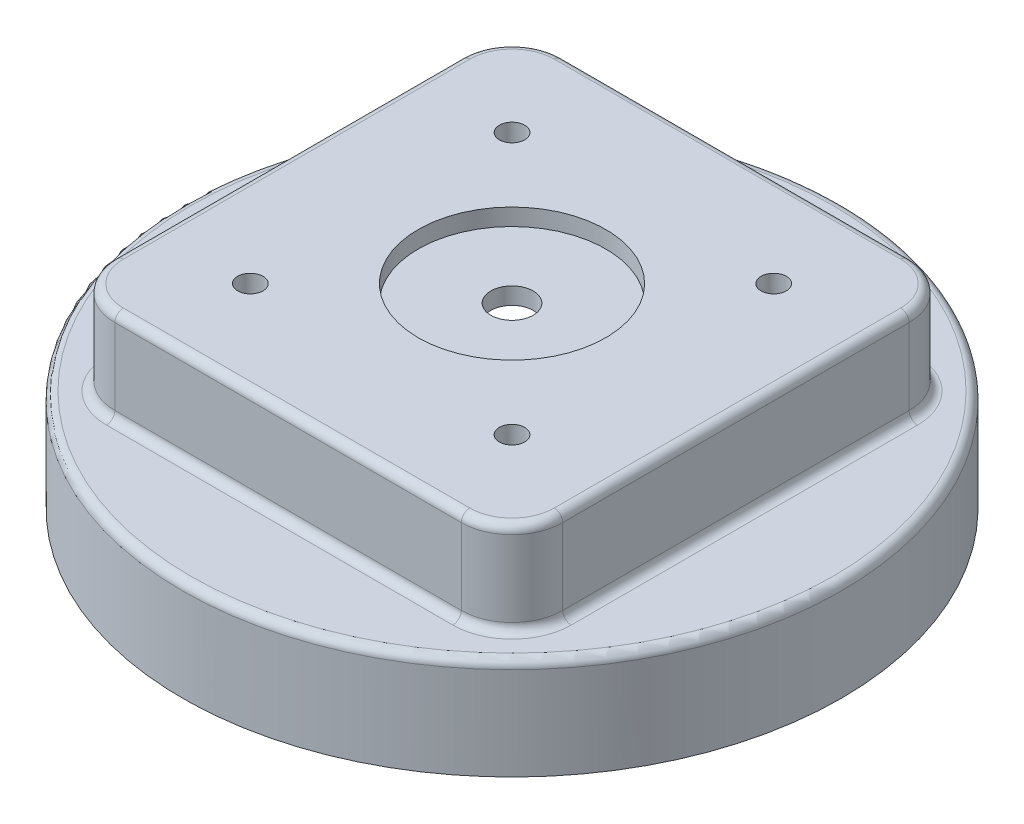
from build123d import *

# Parameters (mm, degrees)
SKETCH1_R           = 39
SKETCH1_R_2         = 35
BOSS_EXTRUDE1_DEPTH = 8
SKETCH2_R           = 39
BOSS_EXTRUDE2_DEPTH = 4
BOSS_EXTRUDE3_DEPTH = 7
BOSS_EXTRUDE4_DEPTH = 4
SKETCH5_R           = 11.1
CUT_EXTRUDE1_DEPTH  = 2
SKETCH6_R           = 1.5
SKETCH6_R_2         = 2.5
CUT_EXTRUDE2_DEPTH  = 60.757844673
FILLET1_R           = 1
FILLET2_R           = 1
SKETCH7_R           = 10.6
CUT_EXTRUDE3_DEPTH  = 50


with BuildPart() as part:
    # Sketch1 → Boss-Extrude1 (new body)
    with BuildSketch(Plane(origin=(0, 0, 0), x_dir=(1, 0, 0), z_dir=(0, 1, 0))):
        Circle(SKETCH1_R)
        Circle(SKETCH1_R_2, mode=Mode.SUBTRACT)
    extrude(amount=BOSS_EXTRUDE1_DEPTH)

    # Sketch2 → Boss-Extrude2 (add)
    with BuildSketch(Plane(origin=(0, 8, 0), x_dir=(1, 0, 0), z_dir=(0, 1, 0))):
        Circle(SKETCH2_R)
        with BuildLine():
            Line((-20.5, -22.5), (20.5, -22.5))
            ThreePointArc((20.5, -22.5), (21.914213562, -21.914213562), (22.5, -20.5))
            Line((22.5, -20.5), (22.5, 20.5))
            ThreePointArc((22.5, 20.5), (21.914213562, 21.914213562), (20.5, 22.5))
            Line((20.5, 22.5), (-20.5, 22.5))
            ThreePointArc((-20.5, 22.5), (-21.914213562, 21.914213562), (-22.5, 20.5))
            Line((-22.5, 20.5), (-22.5, -20.5))
            ThreePointArc((-22.5, -20.5), (-21.914213562, -21.914213562), (-20.5, -22.5))
        make_face(mode=Mode.SUBTRACT)
    extrude(amount=BOSS_EXTRUDE2_DEPTH)

    # Sketch3 → Boss-Extrude3 (add)
    with BuildSketch(Plane(origin=(0, 12, 0), x_dir=(1, 0, 0), z_dir=(0, 1, 0))):
        with BuildLine():
            Line((-20.5, -26.5), (20.5, -26.5))
            ThreePointArc((20.5, -26.5), (24.742640687, -24.742640687), (26.5, -20.5))
            Line((26.5, -20.5), (26.5, 20.5))
            ThreePointArc((26.5, 20.5), (24.742640687, 24.742640687), (20.5, 26.5))
            Line((20.5, 26.5), (-20.5, 26.5))
            ThreePointArc((-20.5, 26.5), (-24.742640687, 24.742640687), (-26.5, 20.5))
            Line((-26.5, 20.5), (-26.5, -20.5))
            ThreePointArc((-26.5, -20.5), (-24.742640687, -24.742640687), (-20.5, -26.5))
        make_face()
        with BuildLine():
            Line((-20.5, -22.5), (20.5, -22.5))
            ThreePointArc((20.5, -22.5), (21.914213562, -21.914213562), (22.5, -20.5))
            Line((22.5, -20.5), (22.5, 20.5))
            ThreePointArc((22.5, 20.5), (21.914213562, 21.914213562), (20.5, 22.5))
            Line((20.5, 22.5), (-20.5, 22.5))
            ThreePointArc((-20.5, 22.5), (-21.914213562, 21.914213562), (-22.5, 20.5))
            Line((-22.5, 20.5), (-22.5, -20.5))
            ThreePointArc((-22.5, -20.5), (-21.914213562, -21.914213562), (-20.5, -22.5))
        make_face(mode=Mode.SUBTRACT)
    extrude(amount=BOSS_EXTRUDE3_DEPTH)

    # Sketch4 → Boss-Extrude4 (add)
    with BuildSketch(Plane(origin=(0, 19, 0), x_dir=(1, 0, 0), z_dir=(0, 1, 0))):
        with BuildLine():
            Line((-20.5, -26.5), (20.5, -26.5))
            ThreePointArc((20.5, -26.5), (24.742640687, -24.742640687), (26.5, -20.5))
            Line((26.5, -20.5), (26.5, 20.5))
            ThreePointArc((26.5, 20.5), (24.742640687, 24.742640687), (20.5, 26.5))
            Line((20.5, 26.5), (-20.5, 26.5))
            ThreePointArc((-20.5, 26.5), (-24.742640687, 24.742640687), (-26.5, 20.5))
            Line((-26.5, 20.5), (-26.5, -20.5))
            ThreePointArc((-26.5, -20.5), (-24.742640687, -24.742640687), (-20.5, -26.5))
        make_face()
    extrude(amount=BOSS_EXTRUDE4_DEPTH)

    # Sketch5 → Cut-Extrude1 (cut)
    with BuildSketch(Plane(origin=(0, 23, 0), x_dir=(1, 0, 0), z_dir=(0, 1, 0))):
        Circle(SKETCH5_R)
    extrude(amount=-CUT_EXTRUDE1_DEPTH, mode=Mode.SUBTRACT)

    # Sketch6 → Cut-Extrude2 (cut, through all)
    with BuildSketch(Plane(origin=(0, 23, 0), x_dir=(1, 0, 0), z_dir=(0, 1, 0))):
        with Locations((-15.485638508, 15.485638508)):
            Circle(SKETCH6_R)
        with Locations((15.485638508, 15.485638508)):
            Circle(SKETCH6_R)
        with Locations((15.485638508, -15.485638508)):
            Circle(SKETCH6_R)
        with Locations((-15.485638508, -15.485638508)):
            Circle(SKETCH6_R)
        Circle(SKETCH6_R_2)
    extrude(amount=-CUT_EXTRUDE2_DEPTH, mode=Mode.SUBTRACT)

    # Fillet1
    fillet1_edges = [part.edges().sort_by_distance(p)[0] for p in [
        (24.742640687, 12, 24.742640687),
        (26.5, 12, 0),
        (24.742640687, 12, -24.742640687),
        (0, 12, -26.5),
        (-24.742640687, 12, -24.742640687),
        (-26.5, 12, 0),
        (-24.742640687, 12, 24.742640687),
        (0, 12, 26.5),
        (-39, 12, 0),
    ]]
    fillet(fillet1_edges, radius=FILLET1_R)

    # Fillet2
    fillet2_edges = [part.edges().sort_by_distance(p)[0] for p in [
        (-24.742640687, 23, -24.742640687),
        (0, 23, -26.5),
        (24.742640687, 23, -24.742640687),
        (26.5, 23, 0),
        (24.742640687, 23, 24.742640687),
        (0, 23, 26.5),
        (-24.742640687, 23, 24.742640687),
        (-26.5, 23, 0),
    ]]
    fillet(fillet2_edges, radius=FILLET2_R)

    # Sketch7 → Cut-Extrude3 (cut)
    with BuildSketch(Plane(origin=(0, 0, 0), x_dir=(0, 0, -1), z_dir=(1, 0, 0))):
        with Locations((0, -2.75)):
            Circle(SKETCH7_R)
    extrude(amount=-CUT_EXTRUDE3_DEPTH, mode=Mode.SUBTRACT)


solid = part.part
